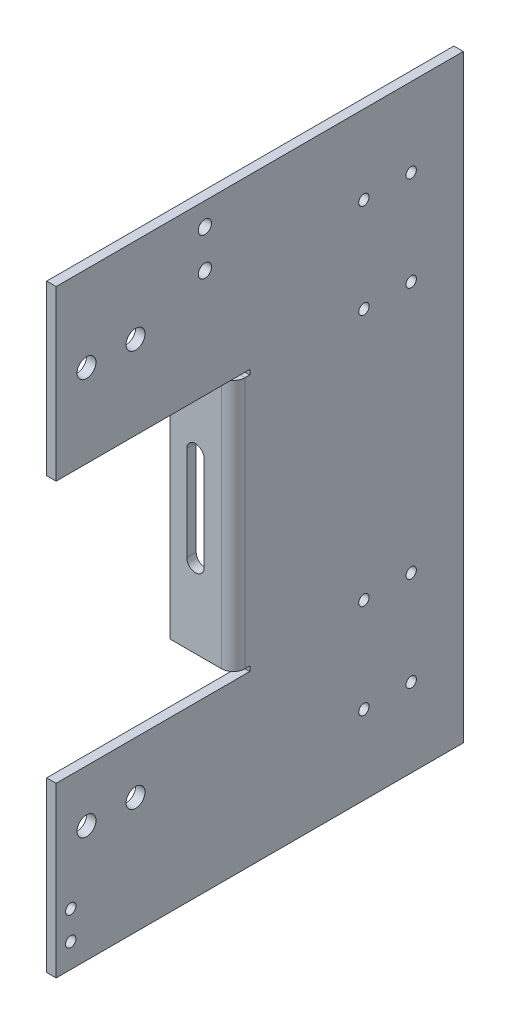
from build123d import *

# Parameters (mm, degrees)
SKETCH_2_W               = 3
SKETCH_2_H               = 190
SM_BASE_FLANGE_1_DEPTH   = 89.2
SKETCH_14_W              = 16.2
SKETCH_14_H              = 80
CUT_EXTRUDE_2_DEPTH      = 10
SM_START                 = 53.5
SM_EDGE_FLANGE_1_DEPTH   = 83
SM_EDGE_FLANGE_1_2_DEPTH = 1.5
SM_START_2               = 135
SM_EDGE_FLANGE_1_3_DEPTH = 1.5
SM_START_3               = 55
SM_EDGE_FLANGE_1_4_DEPTH = 80
CUT_EXTRUDE_START        = -1.5
SKETCH_18_W              = 3
SKETCH_18_H              = 16.2
CUT_EXTRUDE_3_DEPTH      = 1.5
SKETCH_19_W              = 3
SKETCH_19_H              = 16.2
CUT_EXTRUDE_4_DEPTH      = 1.5
CUT_EXTRUDE_5_DEPTH      = 10
HOLE_WIZARD_M4_2_D       = 3.3
HOLE_WIZARD_M4_2_DEPTH   = 10.1
HOLE_WIZARD_M4_2_TIP     = 0.991420021
HOLE_WIZARD_M5_1_D       = 4.2
HOLE_WIZARD_M5_1_DEPTH   = 12.4
HOLE_WIZARD_M5_1_TIP     = 1.2618073
SKETCH_25_W              = 3
SKETCH_25_H              = 53.5
EXTRUDE_1_DEPTH          = 40
SKETCH_26_R              = 3
CUT_EXTRUDE_6_DEPTH      = 3
PATTERN_LINEAR_1_COUNT   = 2
PATTERN_LINEAR_1_PITCH   = 15.55
SKETCH_27_R              = 3
CUT_EXTRUDE_7_DEPTH      = 231.635296518
HOLE_WIZARD_M4_3_D       = 3.3
HOLE_WIZARD_M4_3_DEPTH   = 10.1
HOLE_WIZARD_M4_3_TIP     = 0.991420021


# Read off the part's stored shape, not the designer's step: 边线-法兰1
# Sheet-metal steps are written as plain solids
with BuildPart() as part:
    # Sketch 2 → 基体-法兰1 (new body)
    with BuildSketch(Plane.XY):
        with Locations((1.5, 95)):
            Rectangle(SKETCH_2_W, SKETCH_2_H)
    extrude(amount=SM_BASE_FLANGE_1_DEPTH)

    # 草图14 → 切除-拉伸2 (cut)
    with BuildSketch(Plane(origin=(3, 0, 0), x_dir=(0, 0, -1), z_dir=(1, 0, 0))):
        with Locations((-81.1, 95)):
            Rectangle(SKETCH_14_W, SKETCH_14_H)
    extrude(amount=-CUT_EXTRUDE_2_DEPTH, mode=Mode.SUBTRACT)

    # 边线-法兰1 outline → 边线-法兰1 (cut)
    with BuildSketch(Plane(origin=(0, 0, 0), x_dir=(1, 0, 0), z_dir=(0, 1, 0)).offset(SM_START)):
        with BuildLine():
            Line((3, -73), (3, -69.2634))
            ThreePointArc((3, -69.2634), (2.154295979, -71.630867001), (0, -72.926677222))
            Line((0, -72.926677222), (0, -73))
            Line((0, -73), (3, -73))
        make_face()
    extrude(amount=SM_EDGE_FLANGE_1_DEPTH, mode=Mode.SUBTRACT)

    # Sm Edge Flange 1 2 outline → Sm Edge Flange 1 2 (cut)
    with BuildSketch(Plane(origin=(0, 0, 0), x_dir=(1, 0, 0), z_dir=(0, 1, 0)).offset(SM_START)):
        with BuildLine():
            Line((3, -67.7634), (0, -67.7634))
            Line((0, -67.7634), (0, -72.926677222))
            ThreePointArc((0, -72.926677222), (2.154295979, -71.630867001), (3, -69.2634))
            Line((3, -69.2634), (3, -67.7634))
        make_face()
    extrude(amount=SM_EDGE_FLANGE_1_2_DEPTH, mode=Mode.SUBTRACT)

    # Sm Edge Flange 1 3 outline → Sm Edge Flange 1 3 (cut)
    with BuildSketch(Plane(origin=(0, 0, 0), x_dir=(1, 0, 0), z_dir=(0, 1, 0)).offset(SM_START_2)):
        with BuildLine():
            Line((3, -67.7634), (0, -67.7634))
            Line((0, -67.7634), (0, -72.926677222))
            ThreePointArc((0, -72.926677222), (2.154295979, -71.630867001), (3, -69.2634))
            Line((3, -69.2634), (3, -67.7634))
        make_face()
    extrude(amount=SM_EDGE_FLANGE_1_3_DEPTH, mode=Mode.SUBTRACT)

    # Sm Edge Flange 1 4 outline → Sm Edge Flange 1 4 (add)
    with BuildSketch(Plane(origin=(0, 0, 0), x_dir=(1, 0, 0), z_dir=(0, 1, 0)).offset(SM_START_3)):
        with BuildLine():
            Line((0, -72.926677222), (0, -69.2634))
            ThreePointArc((0, -69.2634), (-0.215745145, -69.784254855), (-0.7366, -70))
            Line((-0.7366, -70), (-17, -70))
            Line((-17, -70), (-17, -73))
            Line((-17, -73), (-0.7366, -73))
            ThreePointArc((-0.7366, -73), (-0.36647982, -72.981624121), (0, -72.926677222))
        make_face()
    extrude(amount=SM_EDGE_FLANGE_1_4_DEPTH)

    # 草图18 → 切除-拉伸3 (cut)
    with BuildSketch(Plane.XZ.offset(-135).offset(CUT_EXTRUDE_START)):
        with Locations((1.5, 81.1)):
            Rectangle(SKETCH_18_W, SKETCH_18_H)
    extrude(amount=CUT_EXTRUDE_3_DEPTH, mode=Mode.SUBTRACT)

    # 草图19 → 切除-拉伸4 (cut)
    with BuildSketch(Plane(origin=(0, 55, 0), x_dir=(1, 0, 0), z_dir=(0, 1, 0)).offset(CUT_EXTRUDE_START)):
        with Locations((1.5, -81.1)):
            Rectangle(SKETCH_19_W, SKETCH_19_H)
    extrude(amount=CUT_EXTRUDE_4_DEPTH, mode=Mode.SUBTRACT)

    # 草图20 → 切除-拉伸5 (cut)
    with BuildSketch(Plane(origin=(0, 0, 70), x_dir=(-1, 0, 0), z_dir=(0, 0, -1))):
        with BuildLine():
            Line((6.25, 80), (6.25, 110))
            ThreePointArc((6.25, 110), (9, 112.75), (11.75, 110))
            Line((11.75, 110), (11.75, 80))
            ThreePointArc((11.75, 80), (9, 77.25), (6.25, 80))
        make_face()
    extrude(amount=-CUT_EXTRUDE_5_DEPTH, mode=Mode.SUBTRACT)

    # M4 螺纹孔2
    with Locations(Plane(origin=(3, 0, 0), x_dir=(0, 0, -1), z_dir=(1, 0, 0))):
        with Locations((-31.544019194, 25), (-16.544019194, 25), (-31.544019194, 55), (-16.544019194, 55), (-16.544019194, 135), (-31.544019194, 135), (-16.544019194, 165), (-31.544019194, 165)):
            Hole(HOLE_WIZARD_M4_2_D / 2, depth=HOLE_WIZARD_M4_2_DEPTH)
            with Locations((0, 0, -(HOLE_WIZARD_M4_2_DEPTH + HOLE_WIZARD_M4_2_TIP / 2))):  # 118° drill point
                Cone(0, HOLE_WIZARD_M4_2_D / 2, HOLE_WIZARD_M4_2_TIP, mode=Mode.SUBTRACT)

    # M5 螺纹孔1
    with Locations(Plane(origin=(3, 0, 0), x_dir=(0, 0, -1), z_dir=(1, 0, 0))):
        with Locations((-82, 170.77), (-82, 182.77)):
            Hole(HOLE_WIZARD_M5_1_D / 2, depth=HOLE_WIZARD_M5_1_DEPTH)
            with Locations((0, 0, -(HOLE_WIZARD_M5_1_DEPTH + HOLE_WIZARD_M5_1_TIP / 2))):  # 118° drill point
                Cone(0, HOLE_WIZARD_M5_1_D / 2, HOLE_WIZARD_M5_1_TIP, mode=Mode.SUBTRACT)

    # 草图25 → 凸台-拉伸1 (add)
    with BuildSketch(Plane.XY.offset(89.2)):
        with Locations((1.5, 163.25)):
            Rectangle(SKETCH_25_W, SKETCH_25_H)
        with Locations((1.5, 26.75)):
            Rectangle(SKETCH_25_W, SKETCH_25_H)
    extrude(amount=EXTRUDE_1_DEPTH)

    # 草图26 → 切除-拉伸6 (cut)
    with BuildSketch(Plane(origin=(3, 0, 0), x_dir=(0, 0, -1), z_dir=(1, 0, 0))):
        with Locations((-119.55, 162.91)):
            Circle(SKETCH_26_R)
    cut_extrude_6 = extrude(amount=-CUT_EXTRUDE_6_DEPTH, mode=Mode.SUBTRACT)

    # 阵列(线性)1: 切除-拉伸6 ×2
    with Locations(*[(0, 0, -i * PATTERN_LINEAR_1_PITCH) for i in range(1, PATTERN_LINEAR_1_COUNT)]):
        add(cut_extrude_6, mode=Mode.SUBTRACT)

    # 草图27 → 切除-拉伸7 (cut, through all)
    with BuildSketch(Plane(origin=(3, 0, 0), x_dir=(0, 0, -1), z_dir=(1, 0, 0))):
        with Locations((-104, 37)):
            Circle(SKETCH_27_R)
        with Locations((-119.55, 37)):
            Circle(SKETCH_27_R)
    extrude(amount=-CUT_EXTRUDE_7_DEPTH, mode=Mode.SUBTRACT)

    # M4 螺纹孔3
    with Locations(Plane(origin=(3, 0, 0), x_dir=(0, 0, -1), z_dir=(1, 0, 0))):
        with Locations((-124.55, 16.7), (-124.55, 7.7)):
            Hole(HOLE_WIZARD_M4_3_D / 2, depth=HOLE_WIZARD_M4_3_DEPTH)
            with Locations((0, 0, -(HOLE_WIZARD_M4_3_DEPTH + HOLE_WIZARD_M4_3_TIP / 2))):  # 118° drill point
                Cone(0, HOLE_WIZARD_M4_3_D / 2, HOLE_WIZARD_M4_3_TIP, mode=Mode.SUBTRACT)


solid = part.part
